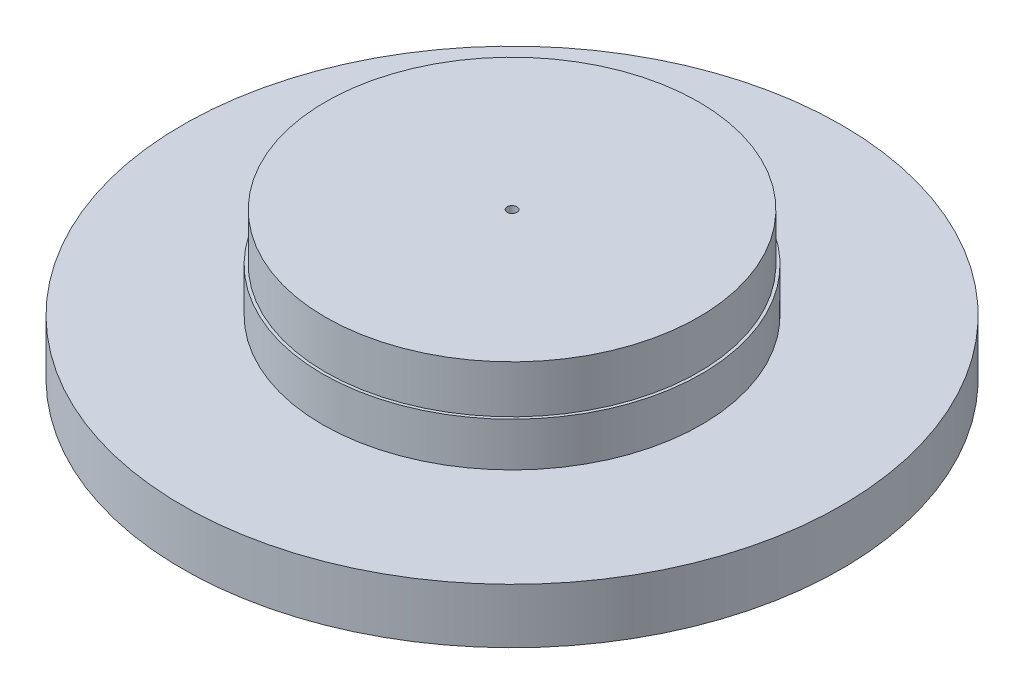
from build123d import *

# Parameters (mm, degrees)
SKETCH1_R                                           = 228.6
SKETCH1_R_2                                         = 131.445
BOSS_EXTRUDE1_DEPTH                                 = 38.1
SKETCH1_3_R                                         = 131.445
SKETCH1_3_R_2                                       = 129.413
BOSS_EXTRUDE2_DEPTH                                 = 68.58
SKETCH1_4_R                                         = 129.413
BOSS_EXTRUDE3_DEPTH                                 = 101.6
CSK_FOR_1_4_FLAT_HEAD_MACHINE_SCREW_100_D           = 6.7564
CSK_FOR_1_4_FLAT_HEAD_MACHINE_SCREW_100_CSINK_D     = 12.8778
CSK_FOR_1_4_FLAT_HEAD_MACHINE_SCREW_100_CSINK_ANGLE = 100


with BuildPart() as part:
    # Sketch1 → Boss-Extrude1 (new body)
    with BuildSketch(Plane(origin=(0, 0, 0), x_dir=(1, 0, 0), z_dir=(0, 1, 0))):
        Circle(SKETCH1_R)
        Circle(SKETCH1_R_2, mode=Mode.SUBTRACT)
    extrude(amount=BOSS_EXTRUDE1_DEPTH)

    # Sketch1<3> → Boss-Extrude2 (add)
    with BuildSketch(Plane(origin=(0, 0, 0), x_dir=(1, 0, 0), z_dir=(0, 1, 0))):
        Circle(SKETCH1_3_R)
        Circle(SKETCH1_3_R_2, mode=Mode.SUBTRACT)
    extrude(amount=BOSS_EXTRUDE2_DEPTH)

    # Sketch1<4> → Boss-Extrude3 (add)
    with BuildSketch(Plane(origin=(0, 0, 0), x_dir=(1, 0, 0), z_dir=(0, 1, 0))):
        Circle(SKETCH1_4_R)
    extrude(amount=BOSS_EXTRUDE3_DEPTH)

    # CSK for 1/4 Flat Head Machine Screw (100)1 (through all)
    with Locations(Plane(origin=(0, 0, 0), x_dir=(-1, 0, 0), z_dir=(0, -1, 0))):
        with Locations((0, 0)):
            CounterSinkHole(CSK_FOR_1_4_FLAT_HEAD_MACHINE_SCREW_100_D / 2, CSK_FOR_1_4_FLAT_HEAD_MACHINE_SCREW_100_CSINK_D / 2, counter_sink_angle=CSK_FOR_1_4_FLAT_HEAD_MACHINE_SCREW_100_CSINK_ANGLE)


solid = part.part
